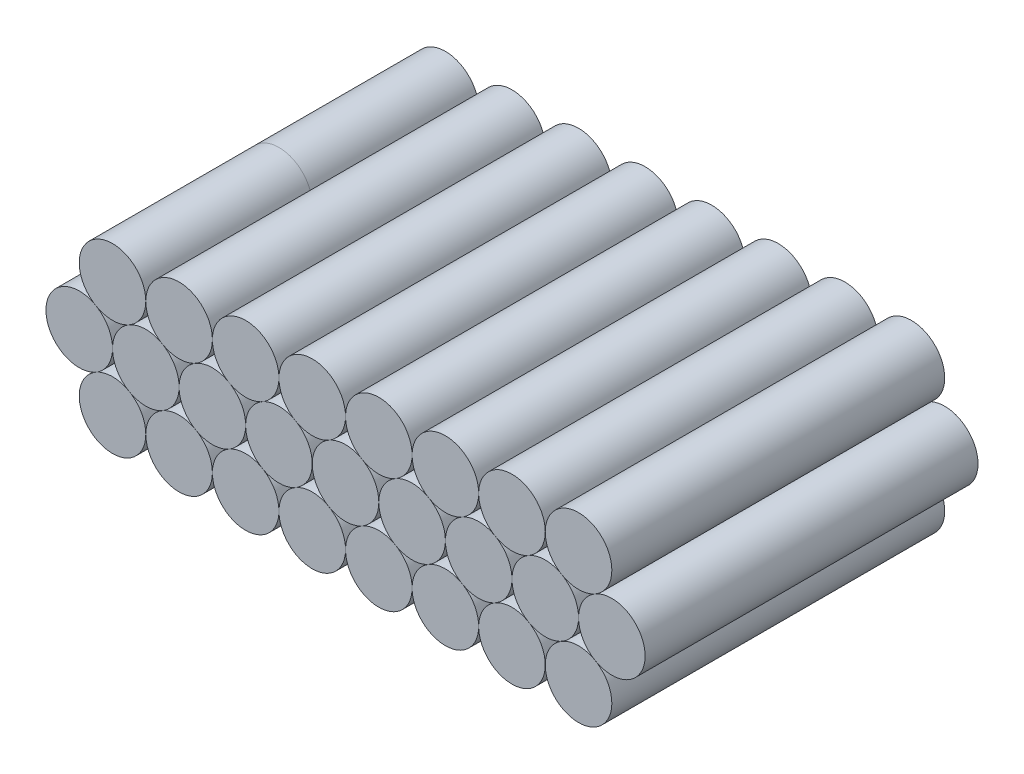
from build123d import *
from build123d.topology import SkipClean

# Parameters (mm, degrees)
SKETCH_1_R         = 10
EXTRUDE_1_DEPTH    = 50
EXTRUDE_1_2_DEPTH  = 50
EXTRUDE_1_3_DEPTH  = 50
EXTRUDE_1_4_DEPTH  = 50
EXTRUDE_1_5_DEPTH  = 50
EXTRUDE_1_6_DEPTH  = 50
EXTRUDE_1_7_DEPTH  = 50
EXTRUDE_1_8_DEPTH  = 50
EXTRUDE_1_9_DEPTH  = 50
EXTRUDE_1_10_DEPTH = 50
EXTRUDE_1_11_DEPTH = 50
EXTRUDE_1_12_DEPTH = 50
EXTRUDE_1_13_DEPTH = 50
EXTRUDE_1_14_DEPTH = 50
EXTRUDE_1_15_DEPTH = 50
EXTRUDE_1_16_DEPTH = 50
EXTRUDE_1_17_DEPTH = 50
EXTRUDE_1_18_DEPTH = 50
EXTRUDE_1_19_DEPTH = 50
EXTRUDE_1_20_DEPTH = 50
EXTRUDE_1_21_DEPTH = 50
EXTRUDE_1_22_DEPTH = 50
EXTRUDE_1_23_DEPTH = 50
EXTRUDE_1_24_DEPTH = 50
EXTRUDE_1_25_DEPTH = 50
EXTRUDE_START      = -50
SKETCH_2_R         = 9.910522244
EXTRUDE_2_DEPTH    = 50


with BuildPart() as part:
    # 草图1 → 凸台-拉伸1 (new body)
    with BuildSketch(Plane.XY):
        with Locations((-60, 34.641016151)):
            Circle(SKETCH_1_R)
    extrude(amount=EXTRUDE_1_DEPTH)



with BuildPart() as body_2:
    # 草图1 → Extrude 1 2 (new body)
    with BuildSketch(Plane.XY):
        with Locations((-70, 17.320508076)):
            Circle(SKETCH_1_R)
    extrude(amount=EXTRUDE_1_2_DEPTH)


with BuildPart() as body_3:
    # 草图1 → Extrude 1 3 (new body)
    with BuildSketch(Plane.XY):
        with Locations((-60, 0)):
            Circle(SKETCH_1_R)
    extrude(amount=EXTRUDE_1_3_DEPTH)


with BuildPart() as body_4:
    # 草图1 → Extrude 1 4 (new body)
    with BuildSketch(Plane.XY):
        with Locations((-50, 17.320508076)):
            Circle(SKETCH_1_R)
    extrude(amount=EXTRUDE_1_4_DEPTH)


with BuildPart() as body_5:
    # 草图1 → Extrude 1 5 (new body)
    with BuildSketch(Plane.XY):
        with Locations((-30, 17.320508076)):
            Circle(SKETCH_1_R)
    extrude(amount=EXTRUDE_1_5_DEPTH)


with BuildPart() as body_6:
    # 草图1 → Extrude 1 6 (new body)
    with BuildSketch(Plane.XY):
        with Locations((-40, 0)):
            Circle(SKETCH_1_R)
    extrude(amount=EXTRUDE_1_6_DEPTH)


with BuildPart() as body_7:
    # 草图1 → Extrude 1 7 (new body)
    with BuildSketch(Plane.XY):
        with Locations((-10, 17.320508076)):
            Circle(SKETCH_1_R)
    extrude(amount=EXTRUDE_1_7_DEPTH)


with BuildPart() as body_8:
    # 草图1 → Extrude 1 8 (new body)
    with BuildSketch(Plane.XY):
        with Locations((-20, 0)):
            Circle(SKETCH_1_R)
    extrude(amount=EXTRUDE_1_8_DEPTH)


with BuildPart() as body_9:
    # 草图1 → Extrude 1 9 (new body)
    with BuildSketch(Plane.XY):
        with Locations((10, 17.320508076)):
            Circle(SKETCH_1_R)
    extrude(amount=EXTRUDE_1_9_DEPTH)


with BuildPart() as body_10:
    # 草图1 → Extrude 1 10 (new body)
    with BuildSketch(Plane.XY):
        with Locations((30, 17.320508076)):
            Circle(SKETCH_1_R)
    extrude(amount=EXTRUDE_1_10_DEPTH)


with BuildPart() as body_11:
    # 草图1 → Extrude 1 11 (new body)
    with BuildSketch(Plane.XY):
        Circle(SKETCH_1_R)
    extrude(amount=EXTRUDE_1_11_DEPTH)


with BuildPart() as body_12:
    # 草图1 → Extrude 1 12 (new body)
    with BuildSketch(Plane.XY):
        with Locations((20, 0)):
            Circle(SKETCH_1_R)
    extrude(amount=EXTRUDE_1_12_DEPTH)


with BuildPart() as body_13:
    # 草图1 → Extrude 1 13 (new body)
    with BuildSketch(Plane.XY):
        with Locations((40, 0)):
            Circle(SKETCH_1_R)
    extrude(amount=EXTRUDE_1_13_DEPTH)


with BuildPart() as body_14:
    # 草图1 → Extrude 1 14 (new body)
    with BuildSketch(Plane.XY):
        with Locations((50, 17.320508076)):
            Circle(SKETCH_1_R)
    extrude(amount=EXTRUDE_1_14_DEPTH)


with BuildPart() as body_15:
    # 草图1 → Extrude 1 15 (new body)
    with BuildSketch(Plane.XY):
        with Locations((40, 34.641016151)):
            Circle(SKETCH_1_R)
    extrude(amount=EXTRUDE_1_15_DEPTH)


with BuildPart() as body_16:
    # 草图1 → Extrude 1 16 (new body)
    with BuildSketch(Plane.XY):
        with Locations((0, 34.641016151)):
            Circle(SKETCH_1_R)
    extrude(amount=EXTRUDE_1_16_DEPTH)


with BuildPart() as body_17:
    # 草图1 → Extrude 1 17 (new body)
    with BuildSketch(Plane.XY):
        with Locations((20, 34.641016151)):
            Circle(SKETCH_1_R)
    extrude(amount=EXTRUDE_1_17_DEPTH)


with BuildPart() as body_18:
    # 草图1 → Extrude 1 18 (new body)
    with BuildSketch(Plane.XY):
        with Locations((-20, 34.641016151)):
            Circle(SKETCH_1_R)
    extrude(amount=EXTRUDE_1_18_DEPTH)


with BuildPart() as body_19:
    # 草图1 → Extrude 1 19 (new body)
    with BuildSketch(Plane.XY):
        with Locations((-40, 34.641016151)):
            Circle(SKETCH_1_R)
    extrude(amount=EXTRUDE_1_19_DEPTH)


with BuildPart() as body_20:
    # 草图1 → Extrude 1 20 (new body)
    with BuildSketch(Plane.XY):
        with Locations((60, 34.641016151)):
            Circle(SKETCH_1_R)
    extrude(amount=EXTRUDE_1_20_DEPTH)


with BuildPart() as body_21:
    # 草图1 → Extrude 1 21 (new body)
    with BuildSketch(Plane.XY):
        with Locations((70, 17.320508076)):
            Circle(SKETCH_1_R)
    extrude(amount=EXTRUDE_1_21_DEPTH)


with BuildPart() as body_22:
    # 草图1 → Extrude 1 22 (new body)
    with BuildSketch(Plane.XY):
        with Locations((60, 0)):
            Circle(SKETCH_1_R)
    extrude(amount=EXTRUDE_1_22_DEPTH)


with BuildPart() as body_23:
    # 草图1 → Extrude 1 23 (new body)
    with BuildSketch(Plane.XY):
        with Locations((-90, 17.320508076)):
            Circle(SKETCH_1_R)
    extrude(amount=EXTRUDE_1_23_DEPTH)


with BuildPart() as body_24:
    # 草图1 → Extrude 1 24 (new body)
    with BuildSketch(Plane.XY):
        with Locations((-80, 0)):
            Circle(SKETCH_1_R)
    extrude(amount=EXTRUDE_1_24_DEPTH)


with BuildPart() as body_25:
    # 草图1 → Extrude 1 25 (new body)
    with BuildSketch(Plane.XY):
        with Locations((-80, 34.641016151)):
            Circle(SKETCH_1_R)
    extrude(amount=EXTRUDE_1_25_DEPTH)


with BuildPart() as part_1:
    with SkipClean():  # the faces are left unmerged after this step: merging them gives an invalid solid
        add(part.part)

        add(body_2.part)  # 凸台-拉伸2 merges body 2

        add(body_3.part)  # 凸台-拉伸2 merges body 3

        add(body_4.part)  # 凸台-拉伸2 merges body 4

        add(body_5.part)  # 凸台-拉伸2 merges body 5

        add(body_6.part)  # 凸台-拉伸2 merges body 6

        add(body_8.part)  # 凸台-拉伸2 merges body 8

        add(body_9.part)  # 凸台-拉伸2 merges body 9

        add(body_10.part)  # 凸台-拉伸2 merges body 10

        add(body_11.part)  # 凸台-拉伸2 merges body 11

        add(body_12.part)  # 凸台-拉伸2 merges body 12

        add(body_13.part)  # 凸台-拉伸2 merges body 13

        add(body_14.part)  # 凸台-拉伸2 merges body 14

        add(body_15.part)  # 凸台-拉伸2 merges body 15

        add(body_16.part)  # 凸台-拉伸2 merges body 16

        add(body_17.part)  # 凸台-拉伸2 merges body 17

        add(body_18.part)  # 凸台-拉伸2 merges body 18

        add(body_19.part)  # 凸台-拉伸2 merges body 19

        add(body_20.part)  # 凸台-拉伸2 merges body 20

        add(body_21.part)  # 凸台-拉伸2 merges body 21

        add(body_22.part)  # 凸台-拉伸2 merges body 22
        # 草图2 → 凸台-拉伸2 (add)
        with BuildSketch(Plane.XY.offset(EXTRUDE_START)):
            with BuildLine():
                ThreePointArc((-10, 0), (0, -10), (10, 0))
                ThreePointArc((10, 0), (8.660254084, 4.99999992), (5.000000161, 8.660253945))
                ThreePointArc((5.000000161, 8.660253945), (-4.99999992, 8.660254084), (-10, 0))
            make_face()
            with BuildLine():
                ThreePointArc((-10, 0), (-14.999999925, 8.660253995), (-24.99999985, 8.660254124))
                ThreePointArc((-24.99999985, 8.660254124), (-28.660253995, 5.000000075), (-30, 0))
                ThreePointArc((-30, 0), (-20, -10), (-10, 0))
            make_face()
            with BuildLine():
                ThreePointArc((10, 0), (20, -10), (30, 0))
                ThreePointArc((30, 0), (28.660254042, 4.999999993), (25.000000014, 8.66025403))
                ThreePointArc((25.000000014, 8.66025403), (20.000000064, 10), (15.000000097, 8.660254094))
                ThreePointArc((15.000000097, 8.660254094), (11.33974599, 5.000000048), (10, 0))
            make_face()
            with BuildLine():
                ThreePointArc((15.000000097, 8.660254094), (18.660254066, 12.320508124), (20, 17.320508076))
                ThreePointArc((20, 17.320508076), (18.660253991, 22.320508156), (14.999999839, 25.980762206))
                ThreePointArc((14.999999839, 25.980762206), (9.99999992, 27.320508076), (5.000000022, 25.980762126))
                ThreePointArc((5.000000022, 25.980762126), (0, 17.320507995), (5.000000161, 8.660253945))
                ThreePointArc((5.000000161, 8.660253945), (10.000000149, 7.320508076), (15.000000097, 8.660254094))
            make_face()
            with BuildLine():
                ThreePointArc((-30, 0), (-31.339745981, 5.000000032), (-35.000000064, 8.660254075))
                ThreePointArc((-35.000000064, 8.660254075), (-40, 10), (-44.999999936, 8.660254075))
                ThreePointArc((-44.999999936, 8.660254075), (-48.660254019, 5.000000032), (-50, 0))
                ThreePointArc((-50, 0), (-40, -10), (-30, 0))
            make_face()
            with BuildLine():
                ThreePointArc((-35.000000064, 8.660254075), (-29.99999995, 7.320508076), (-24.99999985, 8.660254124))
                ThreePointArc((-24.99999985, 8.660254124), (-20, 17.320508225), (-25.000000109, 25.980762177))
                ThreePointArc((-25.000000109, 25.980762177), (-30.000000003, 27.320508076), (-34.999999895, 25.980762174))
                ThreePointArc((-34.999999895, 25.980762174), (-38.660254008, 22.320508128), (-40, 17.320508076))
                ThreePointArc((-40, 17.320508076), (-38.660254056, 12.320508108), (-35.000000064, 8.660254075))
            make_face()
            with BuildLine():
                ThreePointArc((30, 0), (40, -10), (50, 0))
                ThreePointArc((50, 0), (48.660254083, 4.999999921), (45.000000158, 8.660253947))
                ThreePointArc((45.000000158, 8.660253947), (40.000000054, 10), (34.999999936, 8.660254001))
                ThreePointArc((34.999999936, 8.660254001), (31.339745944, 4.999999968), (30, 0))
            make_face()
            with BuildLine():
                ThreePointArc((5.000000022, 25.980762126), (8.660254044, 29.641016162), (10, 34.641016151))
                ThreePointArc((10, 34.641016151), (0, 44.641016151), (-10, 34.641016151))
                ThreePointArc((-10, 34.641016151), (-4.999999989, 25.980762107), (5.000000022, 25.980762126))
            make_face()
            with BuildLine():
                ThreePointArc((-50, 0), (-51.339745941, 4.999999963), (-54.999999925, 8.660253995))
                ThreePointArc((-54.999999925, 8.660253995), (-60.000000155, 10), (-65.000000343, 8.66025384))
                ThreePointArc((-65.000000343, 8.66025384), (-68.660254137, 4.999999828), (-70, 0))
                ThreePointArc((-70, 0), (-60, -10), (-50, 0))
            make_face()
            with BuildLine():
                ThreePointArc((20, 17.320508076), (21.339745966, 12.320508069), (25.000000014, 8.66025403))
                ThreePointArc((25.000000014, 8.66025403), (29.999999971, 7.320508076), (34.999999936, 8.660254001))
                ThreePointArc((34.999999936, 8.660254001), (38.660254019, 12.320508044), (40, 17.320508076))
                ThreePointArc((40, 17.320508076), (38.660253951, 22.320508226), (34.9999997, 25.980762287))
                ThreePointArc((34.9999997, 25.980762287), (29.999999792, 27.320508076), (24.999999939, 25.980762078))
                ThreePointArc((24.999999939, 25.980762078), (21.339745945, 22.320508045), (20, 17.320508076))
            make_face()
            with BuildLine():
                ThreePointArc((50, 0), (65.000000117, -8.66025397), (64.999999766, 8.660254173))
                ThreePointArc((64.999999766, 8.660254173), (59.999999923, 10), (55.0000001, 8.660254095))
                ThreePointArc((55.0000001, 8.660254095), (51.339745991, 5.00000005), (50, 0))
            make_face()
            with BuildLine():
                ThreePointArc((10, 34.641016151), (11.339745916, 29.641016232), (14.999999839, 25.980762206))
                ThreePointArc((14.999999839, 25.980762206), (19.999999872, 24.641016151), (24.999999939, 25.980762078))
                ThreePointArc((24.999999939, 25.980762078), (28.66025402, 29.641016121), (30, 34.641016151))
                ThreePointArc((30, 34.641016151), (20, 44.641016151), (10, 34.641016151))
            make_face()
            with BuildLine():
                ThreePointArc((-25.000000109, 25.980762177), (-15.000000055, 25.980762082), (-10, 34.641016151))
                ThreePointArc((-10, 34.641016151), (-20, 44.641016151), (-30, 34.641016151))
                ThreePointArc((-30, 34.641016151), (-28.660254069, 29.641016206), (-25.000000109, 25.980762177))
            make_face()
            with BuildLine():
                ThreePointArc((-70, 0), (-71.339745946, 4.999999973), (-74.999999945, 8.660254006))
                ThreePointArc((-74.999999945, 8.660254006), (-88.660254054, -4.999999973), (-70, 0))
            make_face()
            with BuildLine():
                ThreePointArc((-40, 17.320508076), (-41.339745941, 22.320508038), (-44.999999925, 25.98076207))
                ThreePointArc((-44.999999925, 25.98076207), (-50.00000005, 27.320508076), (-55.000000161, 25.980762021))
                ThreePointArc((-55.000000161, 25.980762021), (-58.660254084, 22.320507995), (-60, 17.320508076))
                ThreePointArc((-60, 17.320508076), (-58.660254016, 12.320508038), (-54.999999925, 8.660253995))
                ThreePointArc((-54.999999925, 8.660253995), (-49.99999992, 7.320508076), (-44.999999936, 8.660254075))
                ThreePointArc((-44.999999936, 8.660254075), (-41.339745944, 12.320508108), (-40, 17.320508076))
            make_face()
            with BuildLine():
                ThreePointArc((40, 17.320508076), (41.339746008, 12.320507997), (45.000000158, 8.660253947))
                ThreePointArc((45.000000158, 8.660253947), (50.000000149, 7.320508076), (55.0000001, 8.660254095))
                ThreePointArc((55.0000001, 8.660254095), (58.660254067, 12.320508126), (60, 17.320508076))
                ThreePointArc((60, 17.320508076), (58.660254066, 22.320508027), (55.000000098, 25.980762057))
                ThreePointArc((55.000000098, 25.980762057), (50.000000088, 27.320508076), (45.000000055, 25.980762145))
                ThreePointArc((45.000000055, 25.980762145), (41.339745978, 22.320508103), (40, 17.320508076))
            make_face()
            with BuildLine():
                ThreePointArc((-34.999999895, 25.980762174), (-31.339745932, 29.641016204), (-30, 34.641016151))
                ThreePointArc((-30, 34.641016151), (-40, 44.641016151), (-50, 34.641016151))
                ThreePointArc((-50, 34.641016151), (-48.660254016, 29.641016114), (-44.999999925, 25.98076207))
                ThreePointArc((-44.999999925, 25.98076207), (-39.999999896, 24.641016151), (-34.999999895, 25.980762174))
            make_face()
            with BuildLine():
                ThreePointArc((45.000000055, 25.980762145), (48.660254054, 29.641016179), (50, 34.641016151))
                ThreePointArc((50, 34.641016151), (40, 44.641016151), (30, 34.641016151))
                ThreePointArc((30, 34.641016151), (31.339745876, 29.641016301), (34.9999997, 25.980762287))
                ThreePointArc((34.9999997, 25.980762287), (39.999999859, 24.641016151), (45.000000055, 25.980762145))
            make_face()
            with BuildLine():
                ThreePointArc((-74.999999945, 8.660254006), (-70.000000167, 7.320508076), (-65.000000343, 8.66025384))
                ThreePointArc((-65.000000343, 8.66025384), (-61.339746061, 12.320507904), (-60, 17.320508076))
                ThreePointArc((-60, 17.320508076), (-61.339745944, 22.320508044), (-64.999999936, 25.980762077))
                ThreePointArc((-64.999999936, 25.980762077), (-69.999999686, 27.320508076), (-74.999999521, 25.98076239))
                ThreePointArc((-74.999999521, 25.98076239), (-80, 17.320508321), (-74.999999945, 8.660254006))
            make_face()
            with BuildLine():
                ThreePointArc((60, 17.320508076), (61.339745895, 12.320508193), (64.999999766, 8.660254173))
                ThreePointArc((64.999999766, 8.660254173), (80, 17.320507897), (65.000000075, 25.980762157))
                ThreePointArc((65.000000075, 25.980762157), (61.339745984, 22.320508113), (60, 17.320508076))
            make_face()
            with BuildLine():
                ThreePointArc((-55.000000161, 25.980762021), (-51.339746009, 29.641016071), (-50, 34.641016151))
                ThreePointArc((-50, 34.641016151), (-60, 44.641016151), (-70, 34.641016151))
                ThreePointArc((-70, 34.641016151), (-68.660254019, 29.641016119), (-64.999999936, 25.980762077))
                ThreePointArc((-64.999999936, 25.980762077), (-60.000000056, 24.641016151), (-55.000000161, 25.980762021))
            make_face()
            with BuildLine():
                ThreePointArc((65.000000075, 25.980762157), (64.999999963, 43.301270211), (50, 34.641016151))
                ThreePointArc((50, 34.641016151), (51.33974599, 29.641016102), (55.000000098, 25.980762057))
                ThreePointArc((55.000000098, 25.980762057), (60.0000001, 24.641016151), (65.000000075, 25.980762157))
            make_face()
            with BuildLine():
                ThreePointArc((-70, 34.641016151), (-88.660254176, 39.641015912), (-74.999999521, 25.98076239))
                ThreePointArc((-74.999999521, 25.98076239), (-71.339745824, 29.641016391), (-70, 34.641016151))
            make_face()
            with Locations((-90, 17.320508076)):
                Circle(SKETCH_2_R)
        extrude(amount=EXTRUDE_2_DEPTH)


solid = Compound([body_7.part, body_23.part, body_24.part, body_25.part, part_1.part])
